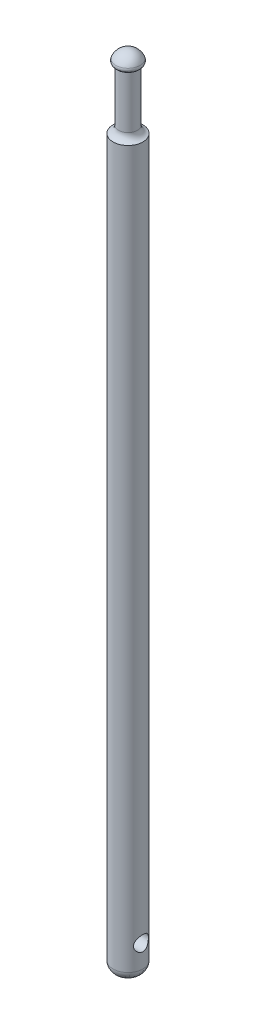
from build123d import *

# Parameters (mm, degrees)
SKETCH1_R               = 2
BOSS_EXTRUDE1_DEPTH     = 104
DOME2_FACE_RADIUS       = 2
DOME2_HEIGHT            = 1.5
CUT_EXTRUDE1_DEPTH      = 105.038454433
CUT_EXTRUDE1_DEPTH_BACK = 105.038454433
SKETCH2_R               = 1
SKETCH6_W               = 0.75
SKETCH6_H               = 8
FILLET1_R               = 0.5
FILLET2_R               = 1


with BuildPart() as part:
    # Sketch1 → Boss-Extrude1 (new body)
    with BuildSketch(Plane(origin=(0, 0, 0), x_dir=(1, 0, 0), z_dir=(0, 1, 0))):
        with Locations(Location((0, 0, 0), (0, 0, 90))):
            Circle(SKETCH1_R)
    extrude(amount=BOSS_EXTRUDE1_DEPTH)

    # Dome2: an elliptical dome of height H over a round flat face of radius A is half a spheroid: the quarter ellipse of half axes A and H revolved about the face's axis
    with BuildSketch(Plane((0, 0, 0), x_dir=(0, 0, 1), z_dir=(1, 0, 0)), mode=Mode.PRIVATE) as dome2_quarter:
        Ellipse(DOME2_FACE_RADIUS, DOME2_HEIGHT)
        Rectangle(DOME2_FACE_RADIUS, DOME2_HEIGHT, align=(Align.MIN, Align.MIN), mode=Mode.INTERSECT)
    revolve(dome2_quarter.sketch, axis=Axis((0, 0, 0), (0, -1, 0)))

    # Sketch2 → Cut-Extrude1 (cut, two sides: drawn at the far end of the back side and taken through both)
    with BuildSketch(Plane(origin=(0, 0, 0), x_dir=(0, 0, -1), z_dir=(1, 0, 0)).offset(-CUT_EXTRUDE1_DEPTH_BACK)):
        with Locations((0, 3)):
            Circle(SKETCH2_R)
    extrude(amount=CUT_EXTRUDE1_DEPTH + CUT_EXTRUDE1_DEPTH_BACK, mode=Mode.SUBTRACT)

    # Sketch5 → Revolve1 (revolve)
    with BuildSketch(Plane.XY):
        with BuildLine():
            Line((0, 102.25), (0, 105.75))
            ThreePointArc((0, 105.75), (1.75, 104), (0, 102.25))
        make_face()
    revolve(axis=Axis((0, 102.25, 0), (0, 1, 0)))

    # Sketch6 → Cut-Revolve1 (revolve, cut)
    with BuildSketch(Plane.XY, mode=Mode.PRIVATE) as cut_revolve1_sk:
        with Locations((1.625, 100)):
            Rectangle(SKETCH6_W, SKETCH6_H)
    revolve(cut_revolve1_sk.sketch.rotate(Axis((0, 105.75, 0), (0, -1, 0)), 180), axis=Axis((0, 105.75, 0), (0, -1, 0)), mode=Mode.SUBTRACT)

    # Fillet1
    # the kernel refuses this fillet: 0.5 mm, written as the material it takes off along each edge
    with BuildSketch(Plane(origin=(0, 104, 0), x_dir=(1, 0, 0), z_dir=(0, 0, -1))) as fillet1_piece_1:
        with BuildLine():
            CenterArc((1.15, -0.489897949), FILLET1_R, 336.926081934, 101.536959033)
            Line((1.61, -0.685857128), (1.6192, -0.689776312))
            ThreePointArc((1.6192, -0.689776312), (1.724440779, -0.352), (1.76, 0))
            Line((1.76, 0), (1.75, 0.01))
            ThreePointArc((1.75, 0.01), (1.5, 0.01), (1.252, 0.009797959))
            Line((1.252, 0.009797959), (1.25, 0))
        make_face()
    revolve(axis=Axis((0, 104, 0), (0, -1, 0)), mode=Mode.SUBTRACT)

    # Fillet2
    # the kernel refuses this fillet: 1 mm, written as the material it adds along each edge
    with BuildSketch(Plane(origin=(0, 96, 0), x_dir=(-1, 0, 0), z_dir=(0, 0, 1))) as fillet2_piece_1:
        with BuildLine():
            CenterArc((2.25, -0.968245837), FILLET2_R, 104.477512186, 75.522487814)
            Line((1.25, -0.968245837), (1.23, -0.968245837))
            Line((1.23, -0.968245837), (1.23, 0))
            Line((1.23, 0), (1.25, 0.02))
            ThreePointArc((1.25, 0.02), (1.625, 0.02), (1.995, 0.019364917))
            Line((1.995, 0.019364917), (2, 0))
        make_face()
    revolve(axis=Axis((0, 96, 0), (0, -1, 0)))


solid = part.part
